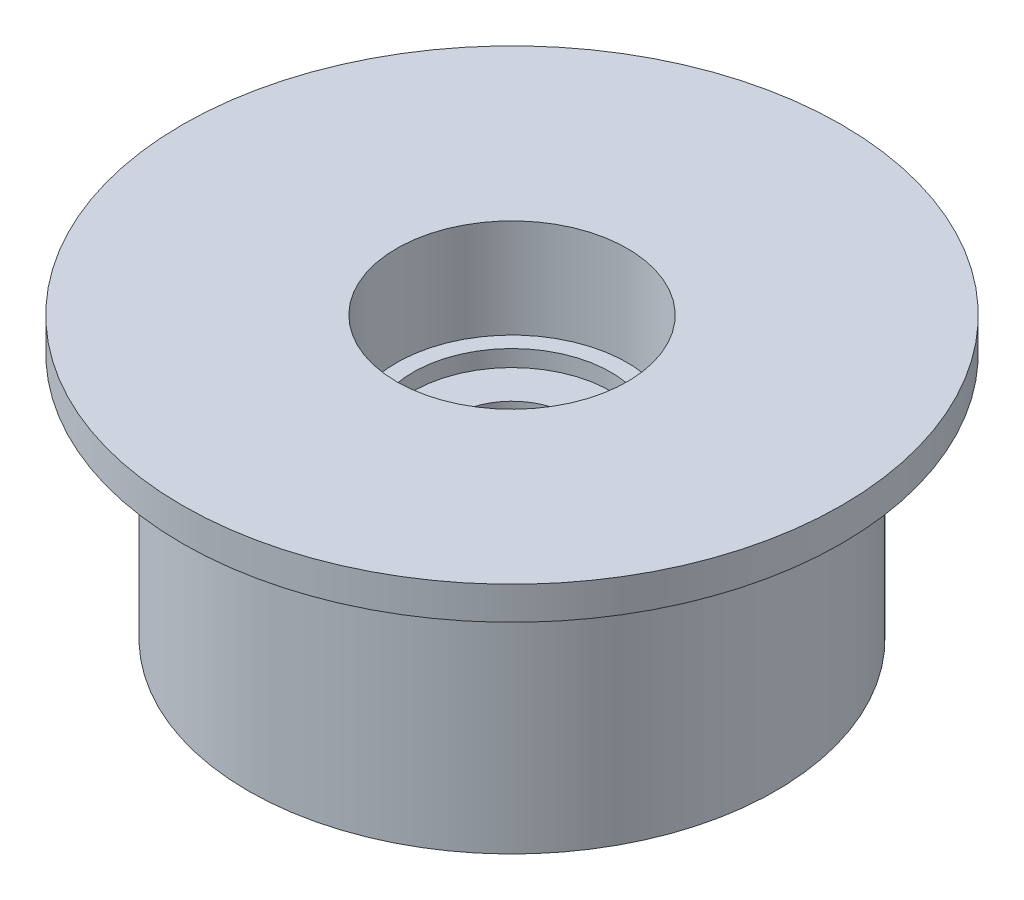
from build123d import *


with BuildPart() as part:
    # Sketch1 → Revolve1 (revolve)
    with BuildSketch(Plane.XY):
        Polygon((1.75, 0), (8, 0), (8, 7.5), (10, 7.5), (10, 8.5), (3.5, 8.5), (3.5, 5.5), (3, 5.5), (3, 5), (1.75, 5), align=None)
    revolve(axis=Axis((0, 37.275, 0), (0, -1, 0)))


solid = part.part
